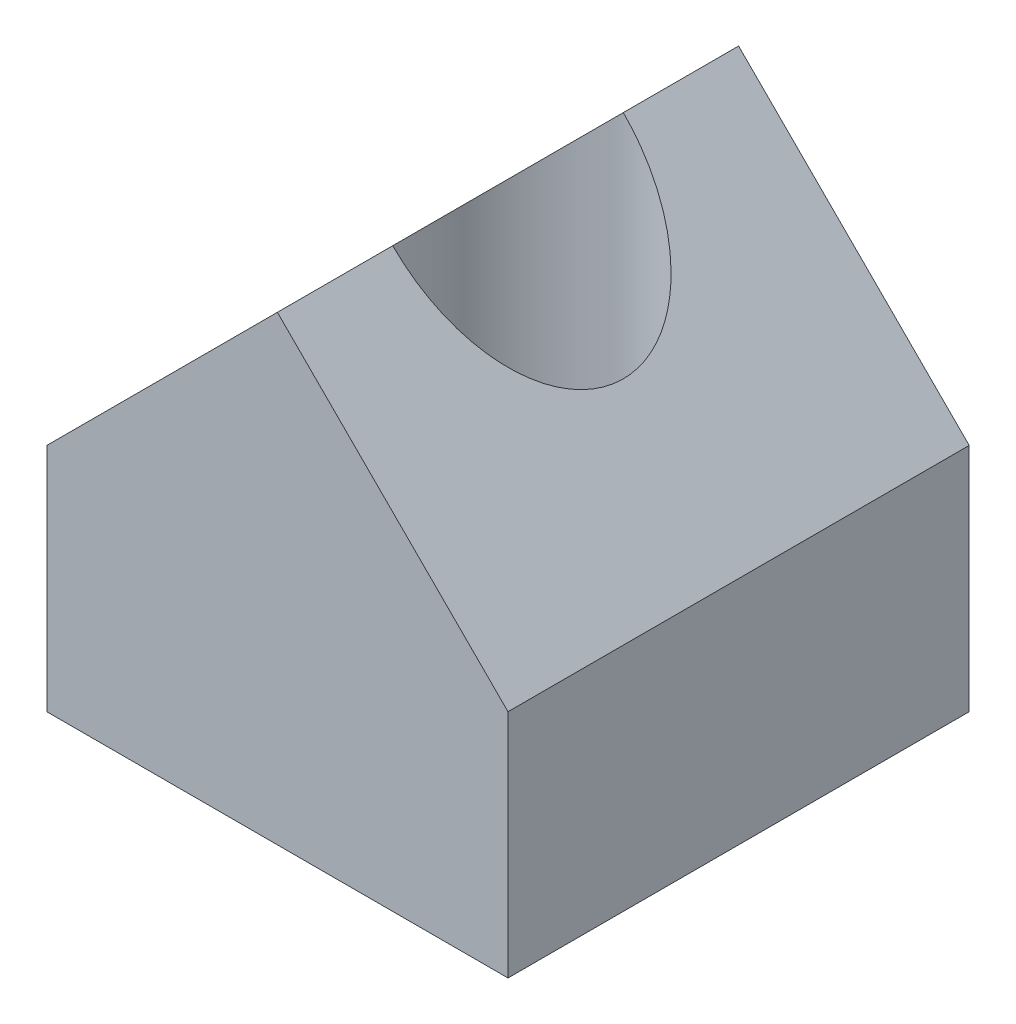
from build123d import *

# Parameters (mm, degrees)
BOSS_EXTRUDE1_DEPTH       = 12.7
SKETCH2_R                 = 3.175
F_25_20_TAPPED_HOLE_DEPTH = 20.05


with BuildPart() as part:
    # Sketch1 → Boss-Extrude1 (new body)
    with BuildSketch(Plane.XY):
        Polygon((6.35, 0), (0, 6.35), (-6.35, 0), (-6.35, -6.35), (6.35, -6.35), align=None)
    extrude(amount=BOSS_EXTRUDE1_DEPTH)

    # Sketch2 → .25-20 tapped hole (cut, through all)
    with BuildSketch(Plane.XZ.offset(6.35)):
        with Locations((0, 6.35)):
            Circle(SKETCH2_R)
    extrude(amount=-F_25_20_TAPPED_HOLE_DEPTH, mode=Mode.SUBTRACT)


solid = part.part
